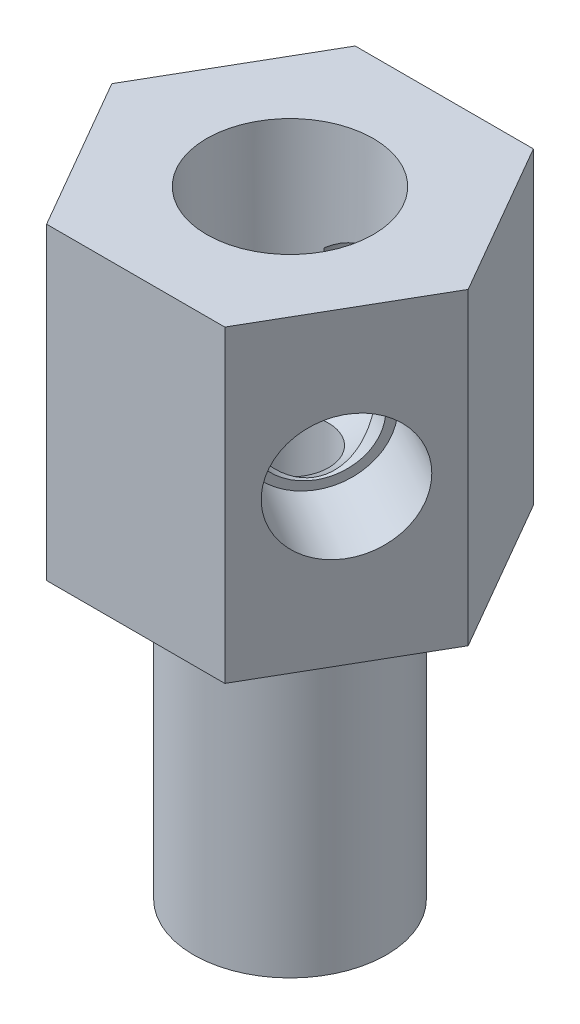
from build123d import *
from OCP.BRepAlgoAPI import BRepAlgoAPI_Cut
from OCP.TopTools import TopTools_ListOfShape

# Parameters (mm, degrees)
SKETCH1_R           = 7.9375
BOSS_EXTRUDE1_DEPTH = 25.4
BOSS_EXTRUDE2_DEPTH = 25.4
SKETCH3_R           = 3.175
CUT_EXTRUDE1_DEPTH  = 55.37815125
SKETCH6_R           = 6.6675
CUT_EXTRUDE2_DEPTH  = 2.38125


with BuildPart() as part:
    # Sketch1 → Boss-Extrude1 (new body)
    with BuildSketch(Plane(origin=(0, 0, 0), x_dir=(1, 0, 0), z_dir=(0, 1, 0))):
        Circle(SKETCH1_R)
    extrude(amount=BOSS_EXTRUDE1_DEPTH)

    # Sketch2 → Boss-Extrude2 (add)
    with BuildSketch(Plane(origin=(0, 25.4, 0), x_dir=(1, 0, 0), z_dir=(0, 1, 0))):
        Polygon((14.664696837, 0), (7.332348419, 12.7), (-7.332348419, 12.7), (-14.664696837, 0), (-7.332348419, -12.7), (7.332348419, -12.7), align=None)
    extrude(amount=BOSS_EXTRUDE2_DEPTH)

    # Sketch3 → Cut-Extrude1 (cut, through all)
    with BuildSketch(Plane.XZ):
        Circle(SKETCH3_R)
    extrude(amount=-CUT_EXTRUDE1_DEPTH, mode=Mode.SUBTRACT)

    # Sketch6 → Cut-Extrude2 (cut)
    with BuildSketch(Plane.XZ.offset(-25.4)):
        Polygon((-14.664696837, 0), (-7.332348419, 12.7), (7.332348419, 12.7), (14.664696837, 0), (7.332348419, -12.7), (-7.332348419, -12.7), align=None)
        Circle(SKETCH6_R, mode=Mode.SUBTRACT)
    extrude(amount=CUT_EXTRUDE2_DEPTH, mode=Mode.SUBTRACT)

    # Sketch4 → 1/4 NPT Tapped Hole1 (revolve, cut)
    with BuildSketch(Plane(origin=(0, 50.8, 0), x_dir=(0, 0, 1), z_dir=(1, 0, 0))):
        Polygon((0, 0), (0, 20.360347279), (5.5626, 17.018), (5.5626, 9.906), (6.557984794, 9.906), (6.8545837, 0), align=None)
    revolve(axis=Axis((0, 57.15, 0), (0, -1, 0)), mode=Mode.SUBTRACT)


with BuildPart() as f_1_8_npt_tapped_hole1_tool:
    # Sketch9 → 1/8 NPT Tapped Hole1 (revolve)
    with BuildSketch(Plane(origin=(10.998522628, 38.1, 6.35), x_dir=(0.4999999999999991, 0, -0.8660254037844392), z_dir=(0, 1, 0))):
        Polygon((0, 0), (0, 14.217468714), (4.2164, 11.684), (4.2164, 6.858), (4.936181096, 6.858), (5.1415188, 0), align=None)
    revolve(axis=Axis((16.497783942, 38.1, 9.525), (-0.8660254037844392, 0, -0.4999999999999991)))


with BuildPart() as part_1:
    add(part.part)

    # 1/8 NPT Tapped Hole1: cut by f_1_8_npt_tapped_hole1_tool, with a tolerance
    f_1_8_npt_tapped_hole1_stock = TopTools_ListOfShape()
    f_1_8_npt_tapped_hole1_stock.Append(part_1.part.wrapped)
    f_1_8_npt_tapped_hole1_tools = TopTools_ListOfShape()
    f_1_8_npt_tapped_hole1_tools.Append(f_1_8_npt_tapped_hole1_tool.part.wrapped)
    f_1_8_npt_tapped_hole1_cut = BRepAlgoAPI_Cut()
    f_1_8_npt_tapped_hole1_cut.SetArguments(f_1_8_npt_tapped_hole1_stock)
    f_1_8_npt_tapped_hole1_cut.SetTools(f_1_8_npt_tapped_hole1_tools)
    f_1_8_npt_tapped_hole1_cut.SetFuzzyValue(0.00001)
    f_1_8_npt_tapped_hole1_cut.Build()
    add(Compound.cast(f_1_8_npt_tapped_hole1_cut.Shape()).solids(), mode=Mode.REPLACE)


with BuildPart() as f_1_8_npt_tapped_hole1_at_2_tool:
    # Sketch9 at point 2 (carried to point 2, square into its face) → 1/8 NPT Tapped Hole1 at 2 (revolve)
    with BuildSketch(Plane(origin=(0, 38.1, -12.7), x_dir=(-1, 0, 0), z_dir=(0, 1, 0))):
        Polygon((0, 0), (0, 14.217468714), (4.2164, 11.684), (4.2164, 6.858), (4.936181096, 6.858), (5.1415188, 0), align=None)
    revolve(axis=Axis((0, 38.1, -19.05), (0, 0, 1)))


with BuildPart() as part_2:
    add(part_1.part)

    # 1/8 NPT Tapped Hole1 at 2: cut by f_1_8_npt_tapped_hole1_at_2_tool, with a tolerance
    f_1_8_npt_tapped_hole1_at_2_stock = TopTools_ListOfShape()
    f_1_8_npt_tapped_hole1_at_2_stock.Append(part_2.part.wrapped)
    f_1_8_npt_tapped_hole1_at_2_tools = TopTools_ListOfShape()
    f_1_8_npt_tapped_hole1_at_2_tools.Append(f_1_8_npt_tapped_hole1_at_2_tool.part.wrapped)
    f_1_8_npt_tapped_hole1_at_2_cut = BRepAlgoAPI_Cut()
    f_1_8_npt_tapped_hole1_at_2_cut.SetArguments(f_1_8_npt_tapped_hole1_at_2_stock)
    f_1_8_npt_tapped_hole1_at_2_cut.SetTools(f_1_8_npt_tapped_hole1_at_2_tools)
    f_1_8_npt_tapped_hole1_at_2_cut.SetFuzzyValue(0.00001)
    f_1_8_npt_tapped_hole1_at_2_cut.Build()
    add(Compound.cast(f_1_8_npt_tapped_hole1_at_2_cut.Shape()).solids(), mode=Mode.REPLACE)


with BuildPart() as f_1_8_npt_tapped_hole1_at_3_tool:
    # Sketch9 at point 3 (carried to point 3, square into its face) → 1/8 NPT Tapped Hole1 at 3 (revolve)
    with BuildSketch(Plane(origin=(-10.998522628, 38.1, 6.35), x_dir=(0.500000175, 0, 0.866025303), z_dir=(0, 1, 0))):
        Polygon((0, 0), (0, 14.217468714), (4.2164, 11.684), (4.2164, 6.858), (4.936181096, 6.858), (5.1415188, 0), align=None)
    revolve(axis=Axis((-16.497783301, 38.1, 9.52500111), (0.866025303, 0, -0.500000175)))


with BuildPart() as part_3:
    add(part_2.part)

    # 1/8 NPT Tapped Hole1 at 3: cut by f_1_8_npt_tapped_hole1_at_3_tool, with a tolerance
    f_1_8_npt_tapped_hole1_at_3_stock = TopTools_ListOfShape()
    f_1_8_npt_tapped_hole1_at_3_stock.Append(part_3.part.wrapped)
    f_1_8_npt_tapped_hole1_at_3_tools = TopTools_ListOfShape()
    f_1_8_npt_tapped_hole1_at_3_tools.Append(f_1_8_npt_tapped_hole1_at_3_tool.part.wrapped)
    f_1_8_npt_tapped_hole1_at_3_cut = BRepAlgoAPI_Cut()
    f_1_8_npt_tapped_hole1_at_3_cut.SetArguments(f_1_8_npt_tapped_hole1_at_3_stock)
    f_1_8_npt_tapped_hole1_at_3_cut.SetTools(f_1_8_npt_tapped_hole1_at_3_tools)
    f_1_8_npt_tapped_hole1_at_3_cut.SetFuzzyValue(0.00001)
    f_1_8_npt_tapped_hole1_at_3_cut.Build()
    add(Compound.cast(f_1_8_npt_tapped_hole1_at_3_cut.Shape()).solids(), mode=Mode.REPLACE)


solid = part_3.part
